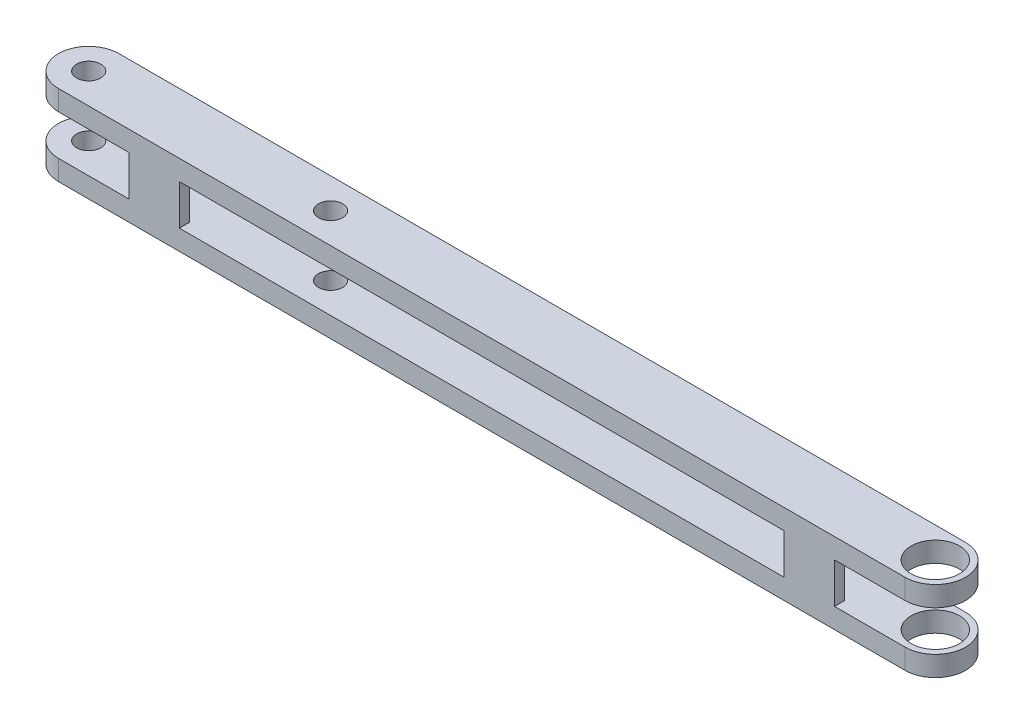
from build123d import *

# Parameters (mm, degrees)
EXTRUDE_1_DEPTH     = 20
SKETCH_2_W          = 150
SKETCH_2_H          = 10
CUT_EXTRUDE_3_DEPTH = 116.244305716
SKETCH_3_W          = 25
SKETCH_3_H          = 10
CUT_EXTRUDE_4_DEPTH = 116.244305716
SKETCH_4_W          = 10
SKETCH_4_H          = 10
CUT_EXTRUDE_5_DEPTH = 202.137390855
SKETCH_5_R          = 3
SKETCH_5_R_2        = 6
CUT_EXTRUDE_6_DEPTH = 115.509824906
SKETCH_6_R          = 3
CUT_EXTRUDE_7_DEPTH = 115.509824906


with BuildPart() as part:
    # 草图1 → 凸台-拉伸1 (new body)
    with BuildSketch(Plane(origin=(0, 0, 0), x_dir=(1, 0, 0), z_dir=(0, 1, 0))):
        with BuildLine():
            Line((-105, 7.5), (105, 7.5))
            ThreePointArc((105, 7.5), (112.5, 0), (105, -7.5))
            Line((105, -7.5), (-105, -7.5))
            ThreePointArc((-105, -7.5), (-112.5, 0), (-105, 7.5))
        make_face()
    extrude(amount=EXTRUDE_1_DEPTH)

    # 草图2 → 切除-拉伸3 (cut, through all)
    with BuildSketch(Plane(origin=(0, 0, -7.5), x_dir=(-1, 0, 0), z_dir=(0, 0, -1))):
        with Locations((0, 10)):
            Rectangle(SKETCH_2_W, SKETCH_2_H)
    extrude(amount=-CUT_EXTRUDE_3_DEPTH, mode=Mode.SUBTRACT)

    # 草图3 → 切除-拉伸4 (cut, through all)
    with BuildSketch(Plane(origin=(0, 0, -7.5), x_dir=(-1, 0, 0), z_dir=(0, 0, -1))):
        with Locations((100, 10)):
            Rectangle(SKETCH_3_W, SKETCH_3_H)
        with Locations((-100, 10)):
            Rectangle(SKETCH_3_W, SKETCH_3_H)
    extrude(amount=-CUT_EXTRUDE_4_DEPTH, mode=Mode.SUBTRACT)

    # 草图4 → 切除-拉伸5 (cut, through all)
    with BuildSketch(Plane.ZY.offset(87.5)):
        with Locations((0, 10)):
            Rectangle(SKETCH_4_W, SKETCH_4_H)
    extrude(amount=-CUT_EXTRUDE_5_DEPTH, mode=Mode.SUBTRACT)

    # 草图5 → 切除-拉伸6 (cut, through all)
    with BuildSketch(Plane(origin=(0, 20, 0), x_dir=(1, 0, 0), z_dir=(0, 1, 0))):
        with Locations((-105, 0)):
            Circle(SKETCH_5_R)
        with Locations((105, 0)):
            Circle(SKETCH_5_R_2)
    extrude(amount=-CUT_EXTRUDE_6_DEPTH, mode=Mode.SUBTRACT)

    # 草图6 → 切除-拉伸7 (cut, through all)
    with BuildSketch(Plane(origin=(0, 20, 0), x_dir=(1, 0, 0), z_dir=(0, 1, 0))):
        with Locations((-45, 0)):
            Circle(SKETCH_6_R)
    extrude(amount=-CUT_EXTRUDE_7_DEPTH, mode=Mode.SUBTRACT)


solid = part.part
